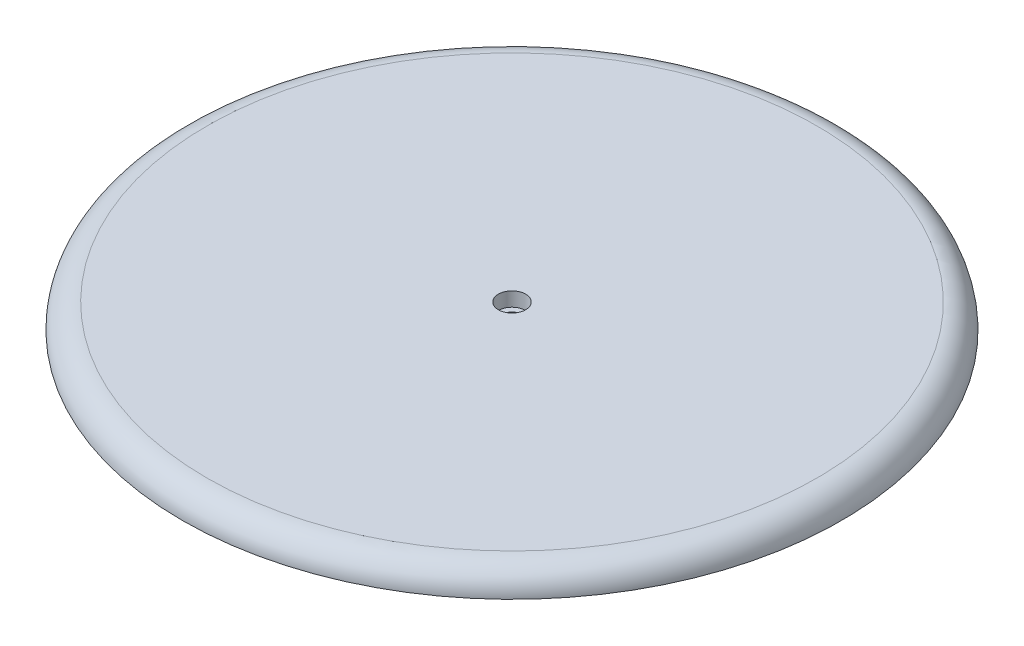
from build123d import *

# Parameters (mm, degrees)
SKETCH1_R           = 67.15
BOSS_EXTRUDE1_DEPTH = 5
SKETCH1_3_R         = 57.15
BOSS_EXTRUDE2_DEPTH = 2
SKETCH2_R           = 2.775
CUT_EXTRUDE1_DEPTH  = 2.89
CUT_EXTRUDE2_REACH  = 97.053
SKETCH3_R           = 1.6
FILLET1_R           = 5


with BuildPart() as part:
    # Sketch1 → Boss-Extrude1 (new body)
    with BuildSketch(Plane(origin=(0, 0, 0), x_dir=(1, 0, 0), z_dir=(0, 1, 0))):
        with Locations(Location((0, 0, 0), (0, 0, 270))):
            Circle(SKETCH1_R)
    extrude(amount=BOSS_EXTRUDE1_DEPTH)

    # Sketch1<3> → Boss-Extrude2 (add)
    with BuildSketch(Plane(origin=(0, 0, 0), x_dir=(1, 0, 0), z_dir=(0, 1, 0))):
        with Locations(Location((0, 0, 0), (0, 0, 270))):
            Circle(SKETCH1_3_R)
    extrude(amount=-BOSS_EXTRUDE2_DEPTH)

    # Sketch2 → Cut-Extrude1 (cut)
    with BuildSketch(Plane(origin=(0, 5, 0), x_dir=(1, 0, 0), z_dir=(0, 1, 0))):
        with Locations(Location((0, 0, 0), (0, 0, 270))):
            Circle(SKETCH2_R)
    extrude(amount=-CUT_EXTRUDE1_DEPTH, mode=Mode.SUBTRACT)

    # Sketch3 → Cut-Extrude2 (cut, up to next)
    with BuildSketch(Plane(origin=(0, 2.11, 0), x_dir=(1, 0, 0), z_dir=(0, 1, 0)), mode=Mode.PRIVATE) as cut_extrude2_sk1:
        with Locations(Location((0, 0, 0), (0, 0, 270))):
            Circle(SKETCH3_R)
    cut_extrude2_tool1 = extrude(cut_extrude2_sk1.sketch, amount=-CUT_EXTRUDE2_REACH, mode=Mode.PRIVATE) & part.part
    add(cut_extrude2_tool1.solids().sort_by_distance((0, 2.11, 0))[0], mode=Mode.SUBTRACT)

    # Fillet1
    fillet1_edges = [part.edges().sort_by_distance(p)[0] for p in [
        (0, 5, -67.15),
    ]]
    fillet(fillet1_edges, radius=FILLET1_R - 0.0001)  # a hair under: the kernel refuses the full size


solid = part.part
